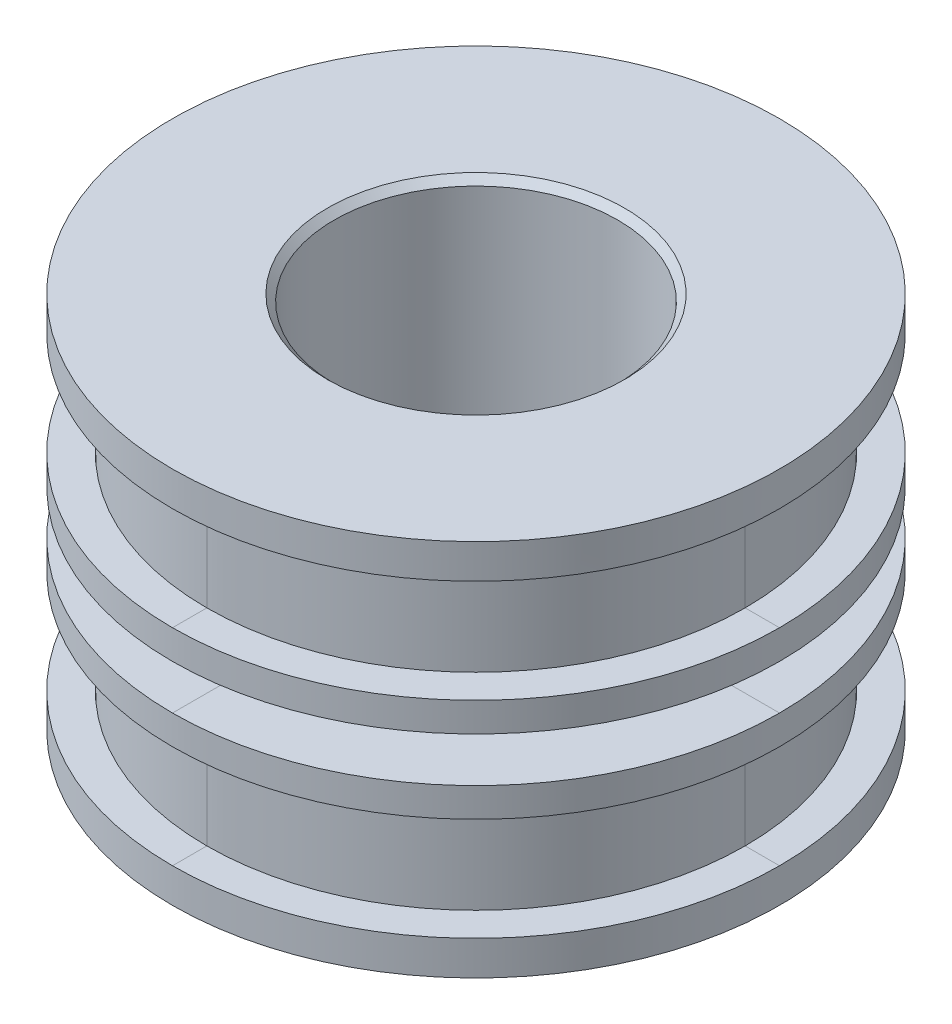
from build123d import *

# Parameters (mm, degrees)
SKETCH1_R           = 44.175
BOSS_EXTRUDE1_DEPTH = 27.5
SKETCH3_W           = 11
SKETCH3_H           = 6.5
SKETCH4_W           = 5
SKETCH4_H           = 15
SKETCH9_R           = 20.625
CUT_EXTRUDE2_DEPTH  = 84.233774695
CHAMFER1_SIZE       = 1
SKETCH10_R          = 24.5
CUT_EXTRUDE3_DEPTH  = 15
CHAMFER2_SIZE       = 1


with BuildPart() as part:
    # Sketch1 → Boss-Extrude1 (new, symmetric)
    with BuildSketch(Plane(origin=(0, 0, 0), x_dir=(1, 0, 0), z_dir=(0, 1, 0))):
        Circle(SKETCH1_R)
    extrude(amount=BOSS_EXTRUDE1_DEPTH, both=True)

    # Cut-Sweep1: sweep along a curve in space
    with BuildLine() as cut_sweep1_path:
        ThreePointArc((0, 27.5, 44.175), (31.236442059, 27.5, 31.236442059), (44.175, 27.5, 0))
        ThreePointArc((44.175, 27.5, 0), (31.236442059, 27.5, -31.236442059), (0, 27.5, -44.175))
        ThreePointArc((0, 27.5, -44.175), (-31.236442059, 27.5, -31.236442059), (-44.175, 27.5, 0))
        ThreePointArc((-44.175, 27.5, 0), (-31.236442059, 27.5, 31.236442059), (0, 27.5, 44.175))
    # Sketch3 → Cut-Sweep1 (sweep, cut)
    with BuildSketch(Plane.XY):
        with Locations((38.675, 0)):
            Rectangle(SKETCH3_W, SKETCH3_H)
    sweep(path=cut_sweep1_path.line, mode=Mode.SUBTRACT)

    # Cut-Sweep2: sweep along a curve in space
    with BuildLine() as cut_sweep2_path:
        ThreePointArc((0, 27.5, 44.175), (31.236442059, 27.5, 31.236442059), (44.175, 27.5, 0))
        ThreePointArc((44.175, 27.5, 0), (31.236442059, 27.5, -31.236442059), (0, 27.5, -44.175))
        ThreePointArc((0, 27.5, -44.175), (-31.236442059, 27.5, -31.236442059), (-44.175, 27.5, 0))
        ThreePointArc((-44.175, 27.5, 0), (-31.236442059, 27.5, 31.236442059), (0, 27.5, 44.175))
    # Sketch4 → Cut-Sweep2 (sweep, cut)
    with BuildSketch(Plane.XY):
        with Locations((41.675, 15)):
            Rectangle(SKETCH4_W, SKETCH4_H)
    cut_sweep2 = sweep(path=cut_sweep2_path.line, mode=Mode.SUBTRACT)

    # Mirror1: Cut-Sweep2 across plane
    add(cut_sweep2.mirror(Plane.ZX), mode=Mode.SUBTRACT)

    # Sketch9 → Cut-Extrude2 (cut, through all)
    with BuildSketch(Plane(origin=(0, 27.5, 0), x_dir=(1, 0, 0), z_dir=(0, 1, 0))):
        Circle(SKETCH9_R)
    extrude(amount=-CUT_EXTRUDE2_DEPTH, mode=Mode.SUBTRACT)

    # Chamfer1
    chamfer1_edges = [part.edges().sort_by_distance(p)[0] for p in [
        (-20.625, 27.5, 0),
    ]]
    chamfer(chamfer1_edges, length=CHAMFER1_SIZE)

    # Sketch10 → Cut-Extrude3 (cut)
    with BuildSketch(Plane.XZ.offset(27.5)):
        Circle(SKETCH10_R)
    extrude(amount=-CUT_EXTRUDE3_DEPTH, mode=Mode.SUBTRACT)

    # Chamfer2
    chamfer2_edges = [part.edges().sort_by_distance(p)[0] for p in [
        (-24.5, -27.5, 0),
    ]]
    chamfer(chamfer2_edges, length=CHAMFER2_SIZE)


solid = part.part
